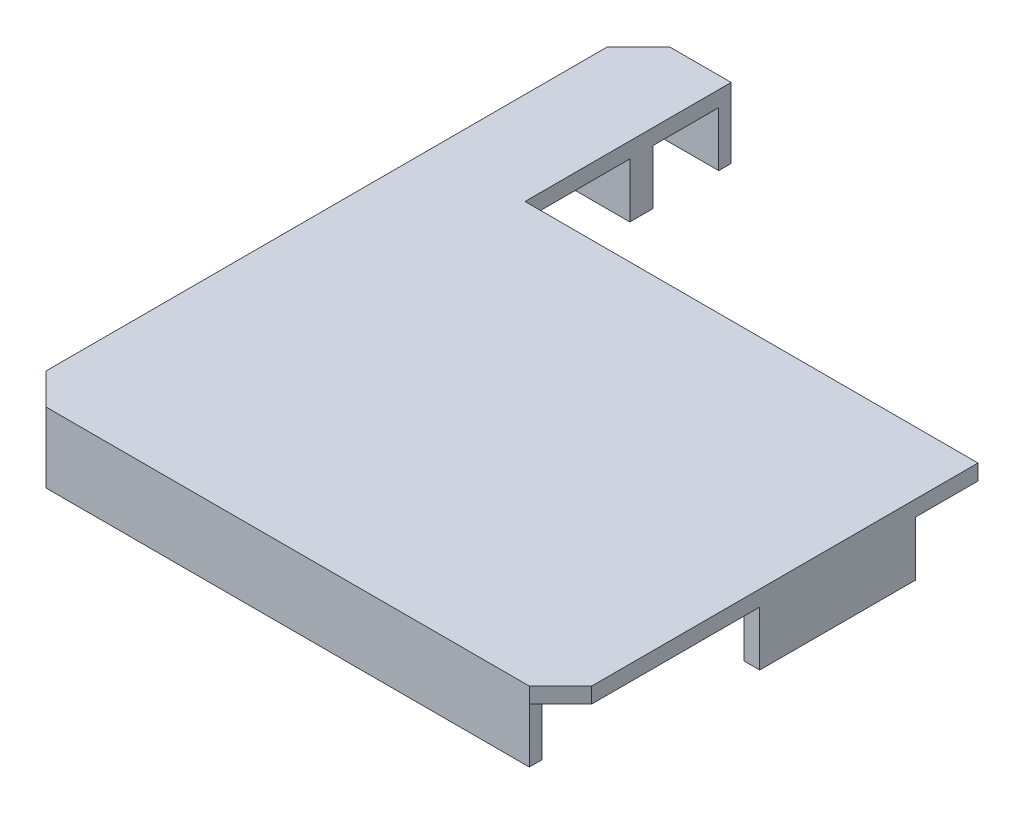
from build123d import *

# Parameters (mm, degrees)
SKETCH_1_W             = 35
SKETCH_1_H             = 40
SM_BASE_FLANGE_1_DEPTH = 1
CHAMFER_1_SIZE         = 2
SKETCH_9_W             = 31
SKETCH_9_H             = 0.8
EXTRUDE_1_DEPTH        = 3.5
CUT_EXTRUDE_1_DEPTH    = 27.804850307
SKETCH_11_W            = 3.944984663
SKETCH_11_H            = 0.8
EXTRUDE_2_DEPTH        = 3.5
SKETCH_12_W            = 1
SKETCH_12_H            = 8
SKETCH_12_H_2          = 10
EXTRUDE_3_DEPTH        = 3.5
SKETCH_13_W            = 6
SKETCH_13_H            = 1.5
SKETCH_13_W_2          = 4.944984663
SKETCH_13_W_3          = 1.5
SKETCH_13_H_2          = 4
EXTRUDE_4_DEPTH        = 3.5


# Sheet-metal steps are written as plain solids
with BuildPart() as part:
    # Sketch 1 → 基体-法兰1 (new body)
    with BuildSketch(Plane(origin=(0, 0, 0), x_dir=(1, 0, 0), z_dir=(0, 1, 0))):
        Rectangle(SKETCH_1_W, SKETCH_1_H)
    extrude(amount=-SM_BASE_FLANGE_1_DEPTH)

    # 倒角1
    chamfer_1_edges = [part.edges().sort_by_distance(p)[0] for p in [
        (17.5, -0.5, 20),
        (-17.5, -0.5, 20),
        (-17.5, -0.5, -20),
        (17.5, -0.5, -20),
    ]]
    chamfer(chamfer_1_edges, length=CHAMFER_1_SIZE)

    # 草图9 → 凸台-拉伸1 (add)
    with BuildSketch(Plane.XZ.offset(1)):
        with Locations((0, 19.6)):
            Rectangle(SKETCH_9_W, SKETCH_9_H)
    extrude(amount=EXTRUDE_1_DEPTH)

    # 草图10 → 切除-拉伸1 (cut, through all)
    with BuildSketch(Plane.XZ.offset(1)):
        Polygon((17.5, -6.777010343), (-11.555015337, -6.777010343), (-11.555015337, -20), (15.5, -20), (17.5, -18), align=None)
    extrude(amount=-CUT_EXTRUDE_1_DEPTH, mode=Mode.SUBTRACT)

    # 草图11 → 凸台-拉伸2 (add)
    with BuildSketch(Plane.XZ.offset(1)):
        with Locations((-13.527507669, -19.6)):
            Rectangle(SKETCH_11_W, SKETCH_11_H)
    extrude(amount=EXTRUDE_2_DEPTH)

    # 草图12 → 凸台-拉伸3 (add)
    with BuildSketch(Plane.XZ.offset(1)):
        with Locations((-17, 9)):
            Rectangle(SKETCH_12_W, SKETCH_12_H)
        with Locations((-17, -9)):
            Rectangle(SKETCH_12_W, SKETCH_12_H)
        with Locations((17, 2.222989657)):
            Rectangle(SKETCH_12_W, SKETCH_12_H_2)
    extrude(amount=EXTRUDE_3_DEPTH)

    # 草图13 → 凸台-拉伸4 (add)
    with BuildSketch(Plane.XZ.offset(1)):
        with Locations((-10.5, -1.027010343)):
            Rectangle(SKETCH_13_W, SKETCH_13_H)
        with Locations((-5.5, 4.472989657)):
            Rectangle(SKETCH_13_W, SKETCH_13_H)
        with Locations((12.5, -4.027010343)):
            Rectangle(SKETCH_13_W, SKETCH_13_H)
        with Locations((-14.027507669, -14.25)):
            Rectangle(SKETCH_13_W_2, SKETCH_13_H)
        with Locations((-1.628117535, 17.2)):
            Rectangle(SKETCH_13_W_3, SKETCH_13_H_2)
    extrude(amount=EXTRUDE_4_DEPTH)


solid = part.part
